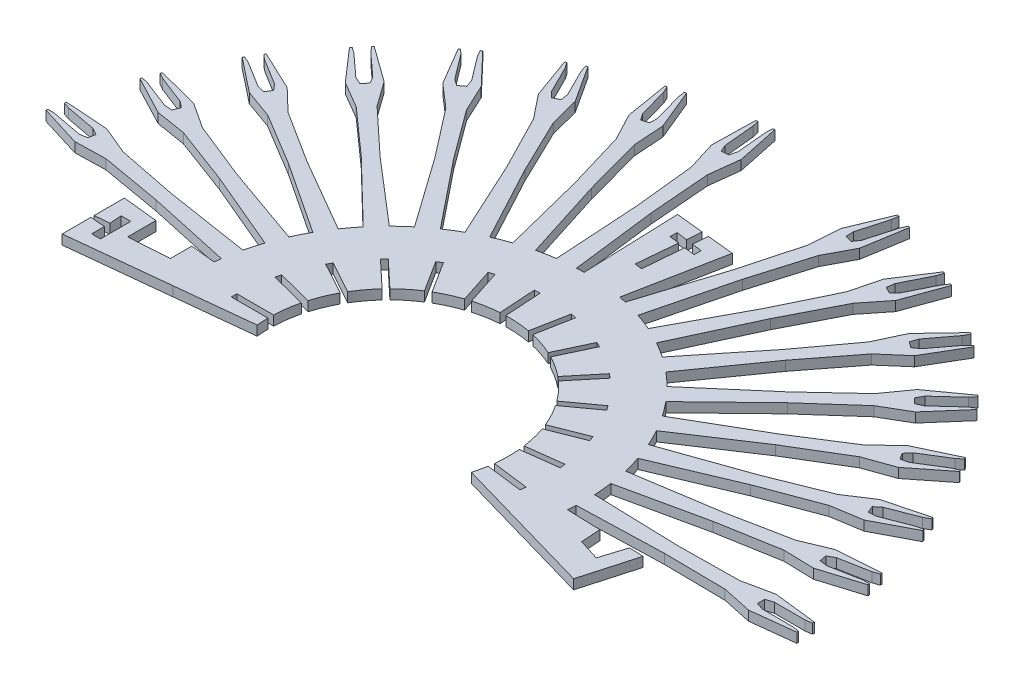
from build123d import *

# Parameters (mm, degrees)
SKETCH2_R               = 6.200163369
BOSS_EXTRUDE1_DEPTH     = 0.5
BOSS_EXTRUDE2_DEPTH     = 0.5
BOSS_EXTRUDE3_DEPTH     = 0.5
CIRPATTERN1_COUNT       = 18
CIRPATTERN1_ANGLE       = 180
CUT_EXTRUDE4_DEPTH      = 103.362617036
CUT_EXTRUDE4_DEPTH_BACK = 0.5
CUT_EXTRUDE6_DEPTH      = 103.362617036
CUT_EXTRUDE6_DEPTH_BACK = 0.5
CUT_EXTRUDE13_DEPTH     = 10
SKETCH13_R              = 2.29112386
SKETCH13_W              = 5.561420579
SKETCH13_H              = 0.286113496
CUT_EXTRUDE14_DEPTH     = 103.362617036


with BuildPart() as part:
    # Sketch2 → Boss-Extrude1 (new body)
    with BuildSketch(Plane(origin=(0, 0, 0), x_dir=(1, 0, 0), z_dir=(0, 1, 0))):
        with BuildLine():
            Line((41.736564116, 50.95828476), (36.555246465, 51.501399508))
            Line((36.555246465, 51.501399508), (36.555246465, 48.286890075))
            Line((36.555246465, 48.286890075), (41.732722408, 48.833722572))
            ThreePointArc((41.732722408, 48.833722572), (41.733244647, 48.828783324), (41.733769301, 48.82384433))
            ThreePointArc((41.733769301, 48.82384433), (50.963390645, 39.773597615), (61.612393233, 47.101054176))
            Line((61.612393233, 47.101054176), (66.500703475, 45.70083261))
            Line((66.500703475, 45.70083261), (67.011967053, 48.840095645))
            Line((67.011967053, 48.840095645), (61.960868148, 49.001189769))
            ThreePointArc((61.960868148, 49.001189769), (59.963353335, 56.003029367), (53.794021492, 59.87022057))
            Line((53.794021492, 59.87022057), (54.740102943, 64.742398272))
            Line((54.740102943, 64.742398272), (51.585987879, 65.064191003))
            Line((51.585987879, 65.064191003), (51.764987526, 60.059419928))
            ThreePointArc((51.764987526, 60.059419928), (45.016500937, 57.426340658), (41.737479755, 50.966991019))
            ThreePointArc((41.737479755, 50.966991019), (41.737020998, 50.962637988), (41.736564116, 50.95828476))
        make_face()
        with Locations((51.841, 49.9)):
            Circle(SKETCH2_R, mode=Mode.SUBTRACT)
    extrude(amount=BOSS_EXTRUDE1_DEPTH)

    # Sketch3 → Boss-Extrude2 (add)
    with BuildSketch(Plane(origin=(0, 0, 0), x_dir=(1, 0, 0), z_dir=(0, 1, 0))):
        Polygon((32.238549372, 50.21), (30.656382721, 50.21), (30.312927172, 50.258547235), (30.312927172, 50.353802971), (32.548549372, 50.609778247), (34.08565504, 50.281862639), (37.255402915, 50.243744905), (41.857469478, 50.381755064), (41.857469478, 49.418244936), (37.255402915, 49.556255095), (34.08565504, 49.518137361), (32.548549372, 49.190221753), (30.312927172, 49.446197029), (30.312927172, 49.541452765), (30.656382721, 49.59), (32.238549372, 49.59), (32.615106949, 49.71386823), (32.615106949, 50.08613177), align=None)
    boss_extrude2 = extrude(amount=BOSS_EXTRUDE2_DEPTH)

    # CirPattern1: Boss-Extrude2 ×18 about axis
    cirpattern1_axis = Axis((51.841, 0.5, -49.9), (0, -1, 0))
    for i in range(1, CIRPATTERN1_COUNT):
        add(boss_extrude2.rotate(cirpattern1_axis, i * CIRPATTERN1_ANGLE / (CIRPATTERN1_COUNT - 1)))

    # Sketch8 → Cut-Extrude4 (cut, two sides: drawn at the far end of the back side and taken through both)
    with BuildSketch(Plane(origin=(0, 0, 0), x_dir=(1, 0, 0), z_dir=(0, 1, 0)).offset(-CUT_EXTRUDE4_DEPTH_BACK)):
        Polygon((36.555246465, 48.286890075), (27.995570216, 47.169676763), (27.995570216, 52.890741223), (36.555246465, 51.501399508), (36.555246465, 48.753981284), align=None)
        Polygon((51.655565612, 72.526598057), (51.585987879, 65.064191003), (54.740102943, 64.742398272), (56.406958129, 72.526598057), align=None)
        Polygon((47.95502979, 51.501399508), (46.998338953, 48.798), (52.839188276, 46.161429513), (54.740102943, 51.719098387), align=None)
    extrude(amount=CUT_EXTRUDE4_DEPTH + CUT_EXTRUDE4_DEPTH_BACK, mode=Mode.SUBTRACT)


with BuildPart() as body_2:
    # Sketch5 → Boss-Extrude3 (new body)
    with BuildSketch(Plane(origin=(0, 0, 0), x_dir=(1, 0, 0), z_dir=(0, 1, 0))):
        Polygon((51.841, 49.9), (51.841, 47.98601508), (47.518666367, 49.9), align=None)
    extrude(amount=BOSS_EXTRUDE3_DEPTH)


with BuildPart() as cut_extrude6_tool:
    # Sketch9 → Cut-Extrude6 (new, two sides: drawn at the far end of the back side and taken through both)
    with BuildSketch(Plane(origin=(0, 0, 0), x_dir=(1, 0, 0), z_dir=(0, 1, 0)).offset(-CUT_EXTRUDE6_DEPTH_BACK)):
        Polygon((36.555246465, 48.286890075), (47.009139853, 49.390092422), (47.587964148, 50.49093808), (51.841, 49.9), (66.500703475, 45.70083261), (51.841, 34.857894493), align=None)
    extrude(amount=CUT_EXTRUDE6_DEPTH + CUT_EXTRUDE6_DEPTH_BACK)


with BuildPart() as part_1:
    add(part.part)

    # Cut-Extrude6: cut by cut_extrude6_tool
    add(cut_extrude6_tool.part, mode=Mode.SUBTRACT)

    # Sketch12 → Cut-Extrude13 (cut)
    with BuildSketch(Plane(origin=(0, 0, 0), x_dir=(1, 0, 0), z_dir=(0, 1, 0))):
        Polygon((36.555246465, 51.501399508), (38.377437868, 51.501399508), (38.377437868, 49.846380566), (40.450129226, 49.985069668), (40.450129226, 51.16915959), (37.317153392, 51.720562063), align=None)
        Polygon((66.036768105, 49.006664529), (65.095153252, 45.671159721), (66.958125451, 45.145241638), (67.462296373, 48.891444034), align=None)
        Polygon((53.08254989, 66.12808357), (52.948117152, 64.171821775), (52.385771098, 64.24300482), (52.385771098, 63.878888302), (52.896048123, 63.814296274), (52.708350835, 61.754583122), (53.087715457, 61.700660527), (53.262410471, 63.755183921), (53.814395603, 63.698049757), (53.814395603, 64.054600552), (53.300329713, 64.12534266), (53.473842648, 66.014949594), align=None)
        Polygon((65.273932949, 48.895526569), (64.858820111, 47.588272269), (63.761063297, 47.936860104), (63.677982038, 49.064928372), (65.504842158, 49.006664529), align=None)
        Polygon((35.431152546, 49.858633501), (37.312510157, 49.997193872), (37.266298078, 50.624656446), (37.766087028, 50.624656446), (37.766087028, 49.051172586), (37.312510157, 49.051172586), (37.312510157, 49.715786798), align=None)
    extrude(amount=CUT_EXTRUDE13_DEPTH, mode=Mode.SUBTRACT)

    # Sketch13 → Cut-Extrude14 (cut, through all)
    with BuildSketch(Plane(origin=(0, 0, 0), x_dir=(1, 0, 0), z_dir=(0, 1, 0))):
        with Locations((51.841102424, 49.89933139)):
            Circle(SKETCH13_R)
        Polygon((49.373582939, 50.469956344), (43.986884615, 51.853025401), (44.058038148, 52.130150114), (49.444736472, 50.747081058), align=None)
        with Locations((46.528485657, 49.981438718)):
            Rectangle(SKETCH13_W, SKETCH13_H)
        Polygon((49.593013257, 51.065676254), (44.719503253, 53.744911051), (44.857339481, 53.995634219), (49.730849484, 51.316399422), align=None)
        Polygon((49.953699285, 51.588110427), (45.899598159, 55.395164789), (46.095456324, 55.603732551), (50.14955745, 51.796678189), align=None)
        Polygon((50.432977793, 52.004432402), (47.453019629, 56.700095102), (47.694593243, 56.853402379), (50.674551407, 52.157739679), align=None)
        Polygon((51.000733951, 52.288483138), (49.282160479, 57.577708419), (49.554270583, 57.666122351), (51.272844055, 52.37689707), align=None)
        Polygon((51.62129355, 52.422414683), (51.272089063, 57.972861068), (51.557637978, 57.990826284), (51.906842466, 52.440379898), align=None)
        Polygon((52.255664549, 52.397811626), (53.297770848, 57.860724156), (53.578816487, 57.807111833), (52.536710188, 52.344199303), align=None)
        Polygon((52.863987086, 52.216219866), (55.2319248, 57.248343656), (55.490808031, 57.126522455), (53.122870317, 52.094398665), align=None)
        Polygon((53.408038017, 51.889049483), (56.953020911, 56.174197688), (57.173475148, 55.991822082), (53.628492254, 51.706673877), align=None)
        Polygon((53.853632622, 51.436857795), (58.352916383, 54.705778792), (58.521089676, 54.474308112), (54.021805915, 51.205387114), align=None)
        Polygon((54.172772553, 50.888057667), (59.343650635, 52.93535313), (59.448976038, 52.66933153), (54.278097956, 50.622036067), align=None)
        Polygon((54.345405075, 50.277132232), (59.862972191, 50.974163056), (59.89883172, 50.690305651), (54.381264604, 49.993274827), align=None)
        Polygon((54.36068305, 49.64246818), (59.878250167, 48.945437356), (59.842390637, 48.66157995), (54.324823521, 49.358610775), align=None)
        Polygon((54.217646509, 49.023943788), (59.388524591, 46.976648325), (59.283199189, 46.710626725), (54.112321107, 48.757922188), align=None)
        Polygon((53.925282963, 48.460423219), (58.424566723, 45.191502221), (58.25639343, 44.960031541), (53.757109669, 48.228952539), align=None)
        Polygon((53.501962688, 47.987314542), (57.046945581, 43.702166338), (56.826491344, 43.519790732), (53.28150845, 47.804938936), align=None)
        Polygon((52.974284454, 47.634344916), (55.342222168, 42.602221126), (55.083338937, 42.480399925), (52.715401223, 47.512523714), align=None)
        Polygon((52.375404226, 47.423692719), (53.417510525, 41.960780189), (53.136464886, 41.907167866), (52.094358587, 47.370080396), align=None)
        Polygon((51.742951851, 47.368594006), (51.393747363, 41.81814762), (51.108198447, 41.836112835), (51.457402935, 47.386559221), align=None)
        Polygon((51.116666637, 47.472510829), (49.398093165, 42.183285548), (49.125983061, 42.271699481), (50.844556533, 47.560924762), align=None)
        Polygon((50.535900388, 47.728913714), (47.555942224, 43.033251014), (47.31436861, 43.186558291), (50.294326774, 47.882220991), align=None)
        Polygon((50.037144783, 48.121691923), (45.983043657, 44.314637561), (45.787185492, 44.523205323), (49.841286617, 48.330259685), align=None)
        Polygon((49.651738471, 48.626165758), (44.778228467, 45.946930961), (44.64039224, 46.197654128), (49.513902243, 48.876888925), align=None)
        Polygon((49.403897948, 49.210637272), (44.017199624, 47.827568216), (43.946046091, 48.10469293), (49.332744415, 49.487761986), align=None)
    extrude(amount=CUT_EXTRUDE14_DEPTH, mode=Mode.SUBTRACT)


with BuildPart() as body_2_1:
    add(body_2.part)

    # Cut-Extrude6: cut by cut_extrude6_tool
    add(cut_extrude6_tool.part, mode=Mode.SUBTRACT)


solid = part_1.part
